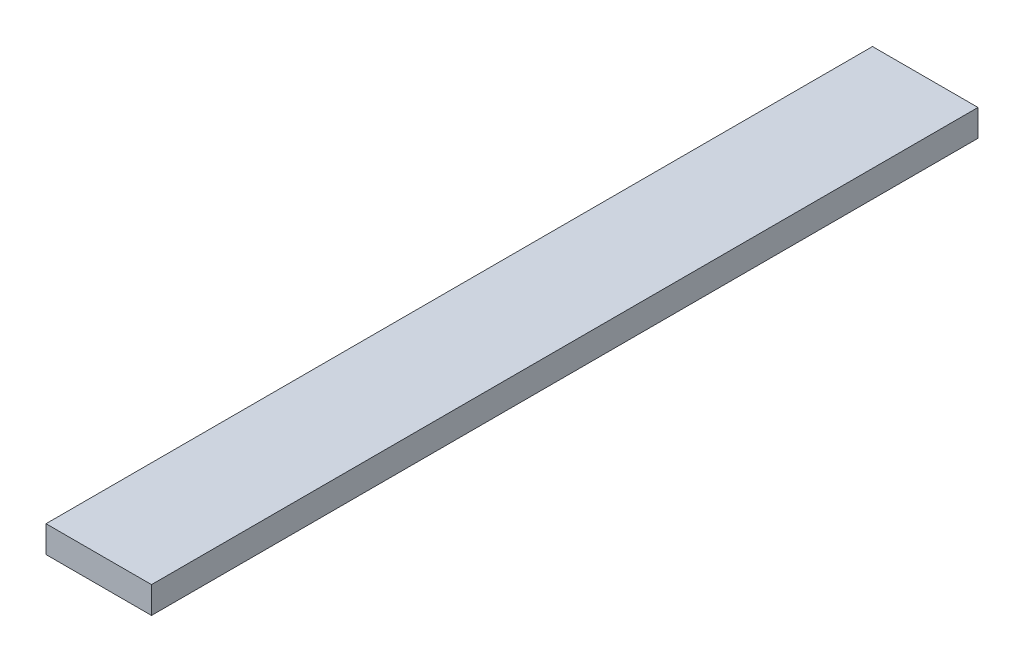
from build123d import *

# Parameters (mm, degrees)
BOSS_EXTRUDE1_DEPTH      = 37
BOSS_EXTRUDE1_DEPTH_BACK = 10
SKETCH2_W                = 6
SKETCH2_H                = 1.519996517


with BuildPart() as part:
    # Sketch2 → Boss-Extrude1 (new, two sides: drawn at the far end of the back side and taken through both)
    with BuildSketch(Plane.XY.offset(-BOSS_EXTRUDE1_DEPTH_BACK)):
        with Locations((-13.5, -6.089995839)):
            Rectangle(SKETCH2_W, SKETCH2_H)
    extrude(amount=BOSS_EXTRUDE1_DEPTH + BOSS_EXTRUDE1_DEPTH_BACK)


solid = part.part
